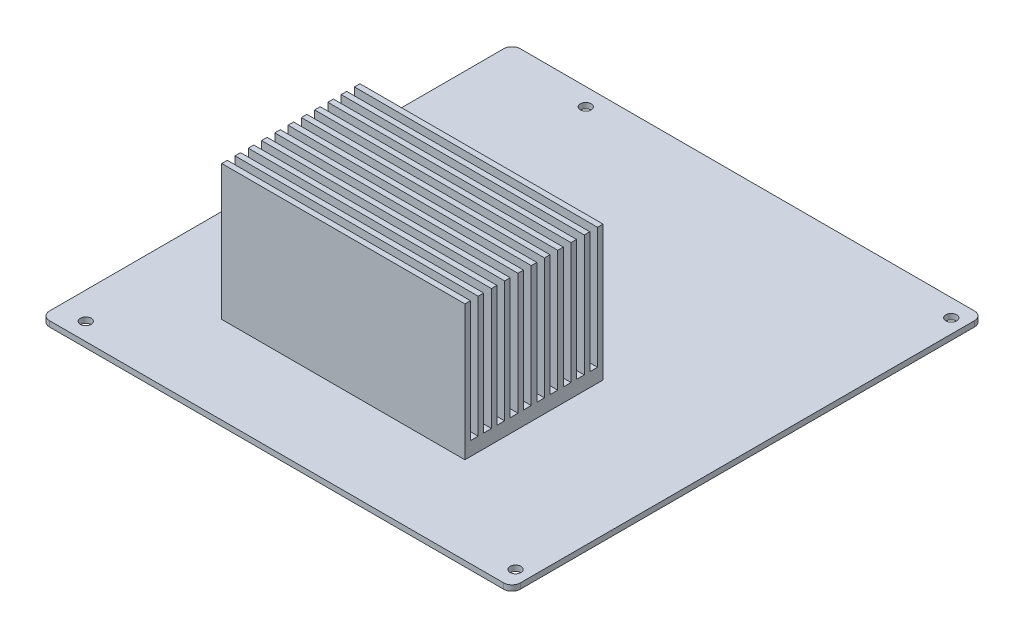
from build123d import *

# Parameters (mm, degrees)
SKETCH1_W                      = 170.18
SKETCH1_H                      = 170.18
BOSS_EXTRUDE1_DEPTH            = 2
SKETCH2_W                      = 87.877229688
SKETCH2_H                      = 49.937509255
BOSS_EXTRUDE2_DEPTH            = 48.8
FILLET1_R                      = 3
F_3_9_3_9_DIAMETER_HOLE1_D     = 3.9
F_3_9_3_9_DIAMETER_HOLE1_DEPTH = 18.75
F_3_9_3_9_DIAMETER_HOLE1_TIP   = 1.171678207
SKETCH6_W                      = 2.793750926
SKETCH6_H                      = 43.8
SKETCH6_W_2                    = 2.793750925
CUT_EXTRUDE1_DEPTH             = 169.610682238


with BuildPart() as part:
    # Sketch1 → Boss-Extrude1 (new body)
    with BuildSketch(Plane(origin=(0, 0, 0), x_dir=(1, 0, 0), z_dir=(0, 1, 0))):
        Rectangle(SKETCH1_W, SKETCH1_H)
    extrude(amount=BOSS_EXTRUDE1_DEPTH)

    # Sketch2 → Boss-Extrude2 (add)
    with BuildSketch(Plane(origin=(0, 2, 0), x_dir=(1, 0, 0), z_dir=(0, 1, 0))):
        with Locations((-7.384779164, -28.607419231)):
            Rectangle(SKETCH2_W, SKETCH2_H)
    extrude(amount=BOSS_EXTRUDE2_DEPTH)

    # Fillet1
    fillet1_edges = [part.edges().sort_by_distance(p)[0] for p in [
        (-85.09, 1, -85.09),
        (85.09, 1, -85.09),
        (85.09, 1, 85.09),
        (-85.09, 1, 85.09),
    ]]
    fillet(fillet1_edges, radius=FILLET1_R)

    # Ø3.9 (3.9) Diameter Hole1
    with Locations(Plane(origin=(0, 2, 0), x_dir=(1, 0, 0), z_dir=(0, 1, 0))):
        with Locations((-75.29, -78.74), (80.01, -78.74), (80.01, 78.74), (-52.07, 78.74)):
            Hole(F_3_9_3_9_DIAMETER_HOLE1_D / 2, depth=F_3_9_3_9_DIAMETER_HOLE1_DEPTH)
            with Locations((0, 0, -(F_3_9_3_9_DIAMETER_HOLE1_DEPTH + F_3_9_3_9_DIAMETER_HOLE1_TIP / 2))):  # 118° drill point
                Cone(0, F_3_9_3_9_DIAMETER_HOLE1_D / 2, F_3_9_3_9_DIAMETER_HOLE1_TIP, mode=Mode.SUBTRACT)

    # Sketch6 → Cut-Extrude1 (cut, through all)
    with BuildSketch(Plane.ZY.offset(51.323394008)):
        with Locations((7.035540067, 28.9)):
            Rectangle(SKETCH6_W, SKETCH6_H)
        with Locations((11.829290993, 28.9)):
            Rectangle(SKETCH6_W_2, SKETCH6_H)
        with Locations((16.623041918, 28.9)):
            Rectangle(SKETCH6_W, SKETCH6_H)
        with Locations((21.416792844, 28.9)):
            Rectangle(SKETCH6_W_2, SKETCH6_H)
        with Locations((26.210543769, 28.9)):
            Rectangle(SKETCH6_W, SKETCH6_H)
        with Locations((31.004294695, 28.9)):
            Rectangle(SKETCH6_W_2, SKETCH6_H)
        with Locations((35.79804562, 28.9)):
            Rectangle(SKETCH6_W, SKETCH6_H)
        with Locations((40.591796546, 28.9)):
            Rectangle(SKETCH6_W_2, SKETCH6_H)
        with Locations((45.385547471, 28.9)):
            Rectangle(SKETCH6_W, SKETCH6_H)
        with Locations((50.179298397, 28.9)):
            Rectangle(SKETCH6_W_2, SKETCH6_H)
    extrude(amount=-CUT_EXTRUDE1_DEPTH, mode=Mode.SUBTRACT)


solid = part.part
